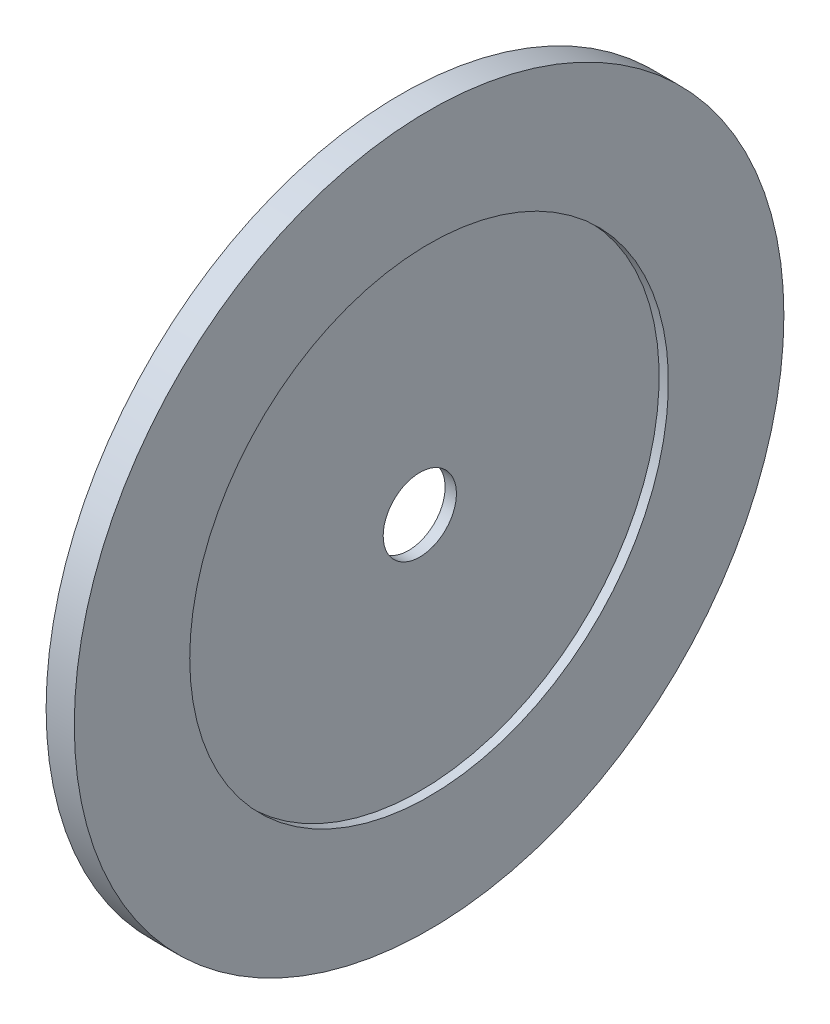
from build123d import *


with BuildPart() as part:
    # Sketch2 → Revolve1 (revolve)
    with BuildSketch(Plane.XY):
        Polygon((-1.34999984, 30.999999976), (-1.34999984, 29.999999944), (-11.349999906, 29.999999944), (-11.349999906, 25.4), (-2.000000064, 25.4), (-2.000000064, 11.499999987), (1.000000032, 11.499999987), (1.000000032, 6.499999954), (2.999999842, 6.499999954), (2.999999842, 42.499999963), (4.650000098, 42.499999963), (4.650000098, 63.000999982), (-0.349999808, 63.000999982), (-0.349999808, 30.999999976), align=None)
    revolve(axis=Axis((0, 0, 0), (1, 0, 0)))


solid = part.part
